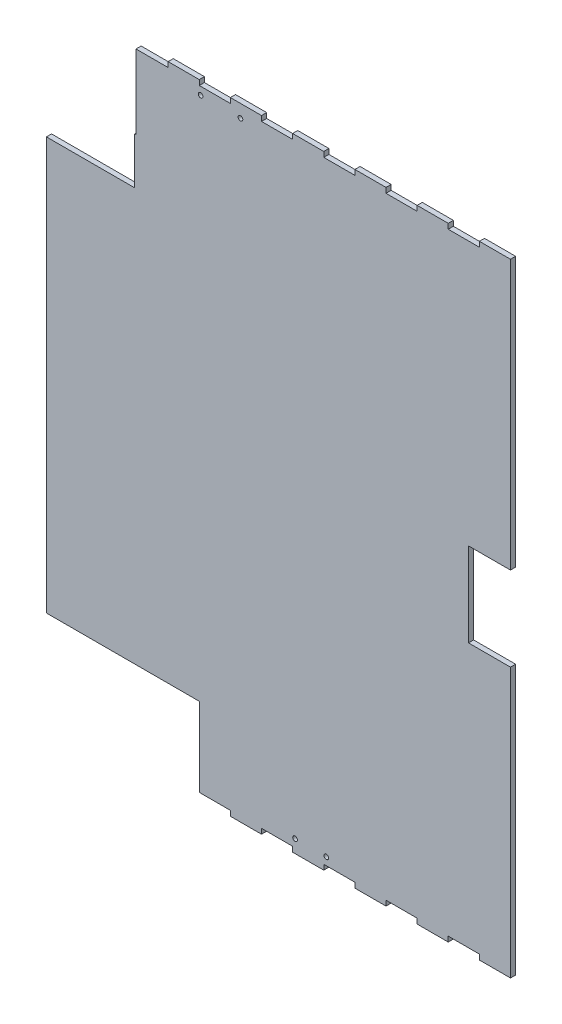
from build123d import *

# Parameters (mm, degrees)
BOSS_EXTRUDE1_DEPTH     = 3.3
SKETCH2_R               = 1.5
CUT_EXTRUDE1_DEPTH      = 453.205952877
CUT_EXTRUDE2_DEPTH      = 455.953272433
CUT_EXTRUDE2_DEPTH_BACK = 455.953272433
SKETCH3_W               = 24.5
SKETCH3_H               = 54
SKETCH4_W               = 26.984189883
SKETCH4_H               = 54
CUT_EXTRUDE3_DEPTH      = 10
SKETCH6_W               = 56.727923661
SKETCH6_H               = 30
CUT_EXTRUDE4_DEPTH      = 10
SKETCH7_W               = 20
SKETCH7_H               = 3.3
BOSS_EXTRUDE2_DEPTH     = 3.3


with BuildPart() as part:
    # Sketch1 → Boss-Extrude1 (new body)
    with BuildSketch(Plane.XY):
        Polygon((25.5, -265), (123.748117859, -265), (123.748117859, -315.7), (323.748117859, -315.7), (323.748117859, 77.7), (83.086263463, 77.7), (83.086263463, 30), (25.5, 30), align=None)
    extrude(amount=BOSS_EXTRUDE1_DEPTH)

    # Sketch2 → Cut-Extrude1 (cut, through all)
    with BuildSketch(Plane(origin=(0, 0, 0), x_dir=(-1, 0, 0), z_dir=(0, 0, -1))):
        with Locations((-150.216261358, 72.7)):
            Circle(SKETCH2_R)
        with Locations((-124.61492379, 72.7)):
            Circle(SKETCH2_R)
        with Locations((-205.394208158, -310.7)):
            Circle(SKETCH2_R)
        with Locations((-185.309760184, -310.7)):
            Circle(SKETCH2_R)
    extrude(amount=-CUT_EXTRUDE1_DEPTH, mode=Mode.SUBTRACT)

    # Sketch3 → Cut-Extrude2 (cut, two sides: drawn at the far end of the back side and taken through both)
    with BuildSketch(Plane(origin=(119.391473557, 0, 256.035841294), x_dir=(0.9063077870366519, 0, -0.42261826174069517), z_dir=(0.42261826174069517, 0, 0.9063077870366519)).offset(-CUT_EXTRUDE2_DEPTH_BACK)):
        with Locations((281.209458836, -119)):
            Rectangle(SKETCH3_W, SKETCH3_H)
    extrude(amount=CUT_EXTRUDE2_DEPTH + CUT_EXTRUDE2_DEPTH_BACK, mode=Mode.SUBTRACT)

    # Sketch4 → Cut-Extrude3 (cut)
    with BuildSketch(Plane(origin=(0, 0, 0), x_dir=(-1, 0, 0), z_dir=(0, 0, -1))):
        with Locations((-310.256022917, -119)):
            Rectangle(SKETCH4_W, SKETCH4_H)
    extrude(amount=-CUT_EXTRUDE3_DEPTH, mode=Mode.SUBTRACT)

    # Sketch6 → Cut-Extrude4 (cut)
    with BuildSketch(Plane.XY.offset(3.3)):
        with Locations((53.863961831, 15)):
            Rectangle(SKETCH6_W, SKETCH6_H)
    extrude(amount=-CUT_EXTRUDE4_DEPTH, mode=Mode.SUBTRACT)

    # Sketch7 → Boss-Extrude2 (add)
    with BuildSketch(Plane(origin=(0, 0, 0), x_dir=(-1, 0, 0), z_dir=(0, 0, -1))):
        with Locations((-193.748117858, -317.35)):
            Rectangle(SKETCH7_W, SKETCH7_H)
        with Locations((-153.748117858, -317.35)):
            Rectangle(SKETCH7_W, SKETCH7_H)
        with Locations((-113.748117859, 79.35)):
            Rectangle(SKETCH7_W, SKETCH7_H)
        with Locations((-153.748117859, 79.35)):
            Rectangle(SKETCH7_W, SKETCH7_H)
        with Locations((-233.748117858, -317.35)):
            Rectangle(SKETCH7_W, SKETCH7_H)
        with Locations((-193.748117859, 79.35)):
            Rectangle(SKETCH7_W, SKETCH7_H)
        with Locations((-273.748117858, -317.35)):
            Rectangle(SKETCH7_W, SKETCH7_H)
        with Locations((-233.748117859, 79.35)):
            Rectangle(SKETCH7_W, SKETCH7_H)
        with Locations((-313.748117858, -317.35)):
            Rectangle(SKETCH7_W, SKETCH7_H)
        with Locations((-273.748117859, 79.35)):
            Rectangle(SKETCH7_W, SKETCH7_H)
        with Locations((-313.748117859, 79.35)):
            Rectangle(SKETCH7_W, SKETCH7_H)
    extrude(amount=-BOSS_EXTRUDE2_DEPTH)


solid = part.part
